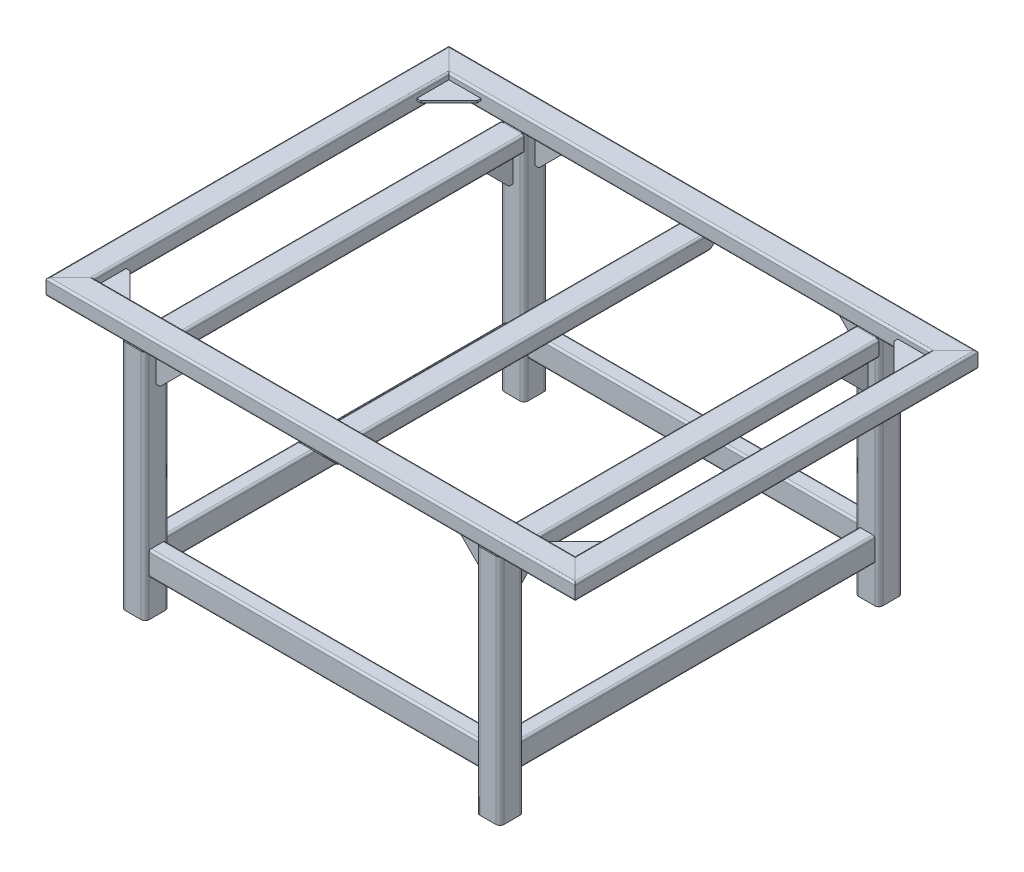
from build123d import *

# Parameters (mm, degrees)
PRINTNC_2X3X125_3_DEPTH            = 1246.790501198
PRINTNC_2X3X125_3_DEPTH_BACK       = 46.790501198
PRINTNC_2X3X125_3_2_DEPTH          = 1693.581002397
PRINTNC_2X3X125_3_3_DEPTH          = 1293.581002397
PRINTNC_2X3X125_3_4_DEPTH          = 1693.581002397
SQUARE_TUBE_3_X_3_X_0_25_3_DEPTH   = 762
SQUARE_TUBE_3_X_3_X_0_25_3_2_DEPTH = 762
SQUARE_TUBE_3_X_3_X_0_25_3_3_DEPTH = 762
SQUARE_TUBE_3_X_3_X_0_25_3_4_DEPTH = 762
PRINTNC_2X3X125_4_DEPTH            = 1170.590501198
PRINTNC_2X3X125_4_DEPTH_BACK       = 46.790501198
PRINTNC_2X3X125_4_2_DEPTH          = 1293.581002397
PRINTNC_2X3X125_4_3_DEPTH          = 1217.381002397
PRINTNC_2X3X125_4_4_DEPTH          = 1293.581002397
PRINTNC_2X3X125_5_DEPTH            = 1200
PRINTNC_2X3X125_5_2_DEPTH          = 1200
GUSSET2_THICKNESS                  = 6.35
GUSSET3_THICKNESS                  = 6.35
GUSSET4_THICKNESS                  = 6.35
GUSSET5_THICKNESS                  = 6.35
GUSSET10_THICKNESS                 = 6.35
GUSSET11_THICKNESS                 = 6.35
GUSSET12_THICKNESS                 = 6.35
GUSSET13_THICKNESS                 = 6.35
GUSSET14_DEPTH                     = 6.35
GUSSET15_DEPTH                     = 6.35
GUSSET16_DEPTH                     = 6.35
GUSSET17_START                     = -6.35
GUSSET17_DEPTH                     = 6.35
PRINTNC_2X3X125_6_DEPTH            = 1276.2
CUT_EXTRUDE1_DEPTH                 = 128


# Read off the part's stored shape, not the designer's step: Gusset14, Gusset15, Gusset16, Gusset17
with BuildPart() as part:
    # Sketch1 → Printnc 2X3X125(3) (new, two sides: drawn at the far end of the back side and taken through both)
    with BuildSketch(Plane(origin=(-800, 0, 600), x_dir=(1, 0, 0), z_dir=(0, 0, -1)).offset(-PRINTNC_2X3X125_3_DEPTH_BACK)):
        with BuildLine():
            Line((31.75, -25.4), (-31.75, -25.4))
            ThreePointArc((-31.75, -25.4), (-36.240128061, -23.540128061), (-38.1, -19.05))
            Line((-38.1, -19.05), (-38.1, 19.05))
            ThreePointArc((-38.1, 19.05), (-36.240128061, 23.540128061), (-31.75, 25.4))
            Line((-31.75, 25.4), (31.75, 25.4))
            ThreePointArc((31.75, 25.4), (36.240128061, 23.540128061), (38.1, 19.05))
            Line((38.1, 19.05), (38.1, -19.05))
            ThreePointArc((38.1, -19.05), (36.240128061, -23.540128061), (31.75, -25.4))
        make_face()
        with BuildLine():
            Line((31.75, 22.225), (-31.75, 22.225))
            ThreePointArc((-31.75, 22.225), (-33.99506403, 21.29506403), (-34.925, 19.05))
            Line((-34.925, 19.05), (-34.925, -19.05))
            ThreePointArc((-34.925, -19.05), (-33.99506403, -21.29506403), (-31.75, -22.225))
            Line((-31.75, -22.225), (31.75, -22.225))
            ThreePointArc((31.75, -22.225), (33.99506403, -21.29506403), (34.925, -19.05))
            Line((34.925, -19.05), (34.925, 19.05))
            ThreePointArc((34.925, 19.05), (33.99506403, 21.29506403), (31.75, 22.225))
        make_face(mode=Mode.SUBTRACT)
    extrude(amount=PRINTNC_2X3X125_3_DEPTH + PRINTNC_2X3X125_3_DEPTH_BACK)

    # Printnc 2X3X125(3) mitre 1
    split(bisect_by=Plane(origin=(-800, 0, 600), x_dir=(0, -1, 0), z_dir=(-0.707106781, 0, -0.707106781)), keep=Keep.TOP)

    # Printnc 2X3X125(3) mitre 2
    split(bisect_by=Plane(origin=(-800, 0, -600), x_dir=(0, -1, 0), z_dir=(-0.707106781, 0, 0.707106781)), keep=Keep.TOP)


with BuildPart() as body_2:
    # Sketch1 on segment 2 (carried to segment 2) → Printnc 2X3X125_3 2 (new body)
    with BuildSketch(Plane(origin=(-846.790501198, 0, -600), x_dir=(0, 0, 1), z_dir=(1, 0, 0))):
        with BuildLine():
            Line((31.75, -25.4), (-31.75, -25.4))
            ThreePointArc((-31.75, -25.4), (-36.240128061, -23.540128061), (-38.1, -19.05))
            Line((-38.1, -19.05), (-38.1, 19.05))
            ThreePointArc((-38.1, 19.05), (-36.240128061, 23.540128061), (-31.75, 25.4))
            Line((-31.75, 25.4), (31.75, 25.4))
            ThreePointArc((31.75, 25.4), (36.240128061, 23.540128061), (38.1, 19.05))
            Line((38.1, 19.05), (38.1, -19.05))
            ThreePointArc((38.1, -19.05), (36.240128061, -23.540128061), (31.75, -25.4))
        make_face()
        with BuildLine():
            Line((31.75, 22.225), (-31.75, 22.225))
            ThreePointArc((-31.75, 22.225), (-33.99506403, 21.29506403), (-34.925, 19.05))
            Line((-34.925, 19.05), (-34.925, -19.05))
            ThreePointArc((-34.925, -19.05), (-33.99506403, -21.29506403), (-31.75, -22.225))
            Line((-31.75, -22.225), (31.75, -22.225))
            ThreePointArc((31.75, -22.225), (33.99506403, -21.29506403), (34.925, -19.05))
            Line((34.925, -19.05), (34.925, 19.05))
            ThreePointArc((34.925, 19.05), (33.99506403, 21.29506403), (31.75, 22.225))
        make_face(mode=Mode.SUBTRACT)
    extrude(amount=PRINTNC_2X3X125_3_2_DEPTH)

    # Printnc 2X3X125_3 2 mitre 1
    split(bisect_by=Plane(origin=(800, 0, -600), x_dir=(0, -1, 0), z_dir=(-0.707106781, 0, -0.707106781)), keep=Keep.TOP)

    # Printnc 2X3X125_3 2 mitre 2
    split(bisect_by=Plane(origin=(-800, 0, -600), x_dir=(0, 1, 0), z_dir=(0.707106781, 0, -0.707106781)), keep=Keep.TOP)


with BuildPart() as body_3:
    # Sketch1 on segment 3 (carried to segment 3) → Printnc 2X3X125_3 3 (new body)
    with BuildSketch(Plane(origin=(800, 0, -646.790501198), x_dir=(-1, 0, 0), z_dir=(0, 0, 1))):
        with BuildLine():
            Line((31.75, -25.4), (-31.75, -25.4))
            ThreePointArc((-31.75, -25.4), (-36.240128061, -23.540128061), (-38.1, -19.05))
            Line((-38.1, -19.05), (-38.1, 19.05))
            ThreePointArc((-38.1, 19.05), (-36.240128061, 23.540128061), (-31.75, 25.4))
            Line((-31.75, 25.4), (31.75, 25.4))
            ThreePointArc((31.75, 25.4), (36.240128061, 23.540128061), (38.1, 19.05))
            Line((38.1, 19.05), (38.1, -19.05))
            ThreePointArc((38.1, -19.05), (36.240128061, -23.540128061), (31.75, -25.4))
        make_face()
        with BuildLine():
            Line((31.75, 22.225), (-31.75, 22.225))
            ThreePointArc((-31.75, 22.225), (-33.99506403, 21.29506403), (-34.925, 19.05))
            Line((-34.925, 19.05), (-34.925, -19.05))
            ThreePointArc((-34.925, -19.05), (-33.99506403, -21.29506403), (-31.75, -22.225))
            Line((-31.75, -22.225), (31.75, -22.225))
            ThreePointArc((31.75, -22.225), (33.99506403, -21.29506403), (34.925, -19.05))
            Line((34.925, -19.05), (34.925, 19.05))
            ThreePointArc((34.925, 19.05), (33.99506403, 21.29506403), (31.75, 22.225))
        make_face(mode=Mode.SUBTRACT)
    extrude(amount=PRINTNC_2X3X125_3_3_DEPTH)

    # Printnc 2X3X125_3 3 mitre 1
    split(bisect_by=Plane(origin=(800, 0, 600), x_dir=(0, 1, 0), z_dir=(0.707106781, 0, -0.707106781)), keep=Keep.TOP)

    # Printnc 2X3X125_3 3 mitre 2
    split(bisect_by=Plane(origin=(800, 0, -600), x_dir=(0, 1, 0), z_dir=(0.707106781, 0, 0.707106781)), keep=Keep.TOP)


with BuildPart() as body_4:
    # Sketch1 on segment 4 (carried to segment 4) → Printnc 2X3X125_3 4 (new body)
    with BuildSketch(Plane(origin=(846.790501198, 0, 600), x_dir=(0, 0, -1), z_dir=(-1, 0, 0))):
        with BuildLine():
            Line((31.75, -25.4), (-31.75, -25.4))
            ThreePointArc((-31.75, -25.4), (-36.240128061, -23.540128061), (-38.1, -19.05))
            Line((-38.1, -19.05), (-38.1, 19.05))
            ThreePointArc((-38.1, 19.05), (-36.240128061, 23.540128061), (-31.75, 25.4))
            Line((-31.75, 25.4), (31.75, 25.4))
            ThreePointArc((31.75, 25.4), (36.240128061, 23.540128061), (38.1, 19.05))
            Line((38.1, 19.05), (38.1, -19.05))
            ThreePointArc((38.1, -19.05), (36.240128061, -23.540128061), (31.75, -25.4))
        make_face()
        with BuildLine():
            Line((31.75, 22.225), (-31.75, 22.225))
            ThreePointArc((-31.75, 22.225), (-33.99506403, 21.29506403), (-34.925, 19.05))
            Line((-34.925, 19.05), (-34.925, -19.05))
            ThreePointArc((-34.925, -19.05), (-33.99506403, -21.29506403), (-31.75, -22.225))
            Line((-31.75, -22.225), (31.75, -22.225))
            ThreePointArc((31.75, -22.225), (33.99506403, -21.29506403), (34.925, -19.05))
            Line((34.925, -19.05), (34.925, 19.05))
            ThreePointArc((34.925, 19.05), (33.99506403, 21.29506403), (31.75, 22.225))
        make_face(mode=Mode.SUBTRACT)
    extrude(amount=PRINTNC_2X3X125_3_4_DEPTH)

    # Printnc 2X3X125_3 4 mitre 1
    split(bisect_by=Plane(origin=(800, 0, 600), x_dir=(0, -1, 0), z_dir=(-0.707106781, 0, 0.707106781)), keep=Keep.TOP)

    # Printnc 2X3X125_3 4 mitre 2
    split(bisect_by=Plane(origin=(-800, 0, 600), x_dir=(0, 1, 0), z_dir=(0.707106781, 0, 0.707106781)), keep=Keep.TOP)


with BuildPart() as body_5:
    # Sketch19 → Square tube 3 X 3 X 0.25(3) (new body)
    with BuildSketch(Plane(origin=(-561.9, 0, 600), x_dir=(1, 0, 0), z_dir=(0, -1, 0))):
        with BuildLine():
            Line((-25.4, -38.1), (25.4, -38.1))
            ThreePointArc((25.4, -38.1), (34.380256121, -34.380256121), (38.1, -25.4))
            Line((38.1, -25.4), (38.1, 25.4))
            ThreePointArc((38.1, 25.4), (34.380256121, 34.380256121), (25.4, 38.1))
            Line((25.4, 38.1), (-25.4, 38.1))
            ThreePointArc((-25.4, 38.1), (-34.380256121, 34.380256121), (-38.1, 25.4))
            Line((-38.1, 25.4), (-38.1, -25.4))
            ThreePointArc((-38.1, -25.4), (-34.380256121, -34.380256121), (-25.4, -38.1))
        make_face()
        with BuildLine():
            Line((-25.4, -31.75), (25.4, -31.75))
            ThreePointArc((25.4, -31.75), (29.890128061, -29.890128061), (31.75, -25.4))
            Line((31.75, -25.4), (31.75, 25.4))
            ThreePointArc((31.75, 25.4), (29.890128061, 29.890128061), (25.4, 31.75))
            Line((25.4, 31.75), (-25.4, 31.75))
            ThreePointArc((-25.4, 31.75), (-29.890128061, 29.890128061), (-31.75, 25.4))
            Line((-31.75, 25.4), (-31.75, -25.4))
            ThreePointArc((-31.75, -25.4), (-29.890128061, -29.890128061), (-25.4, -31.75))
        make_face(mode=Mode.SUBTRACT)
    extrude(amount=SQUARE_TUBE_3_X_3_X_0_25_3_DEPTH)

    # Trim/Extend1
    split(bisect_by=Plane(origin=(0, -25.4, 600.420026042), x_dir=(1, 0, 0), z_dir=(0, -1, 0)), keep=Keep.TOP)


with BuildPart() as body_6:
    # Sketch19 on segment 2 (carried to segment 2) → Square tube 3 X 3 X 0.25_3 2 (new body)
    with BuildSketch(Plane(origin=(-561.9, 0, -600), x_dir=(1, 0, 0), z_dir=(0, -1, 0))):
        with BuildLine():
            Line((-25.4, -38.1), (25.4, -38.1))
            ThreePointArc((25.4, -38.1), (34.380256121, -34.380256121), (38.1, -25.4))
            Line((38.1, -25.4), (38.1, 25.4))
            ThreePointArc((38.1, 25.4), (34.380256121, 34.380256121), (25.4, 38.1))
            Line((25.4, 38.1), (-25.4, 38.1))
            ThreePointArc((-25.4, 38.1), (-34.380256121, 34.380256121), (-38.1, 25.4))
            Line((-38.1, 25.4), (-38.1, -25.4))
            ThreePointArc((-38.1, -25.4), (-34.380256121, -34.380256121), (-25.4, -38.1))
        make_face()
        with BuildLine():
            Line((-25.4, -31.75), (25.4, -31.75))
            ThreePointArc((25.4, -31.75), (29.890128061, -29.890128061), (31.75, -25.4))
            Line((31.75, -25.4), (31.75, 25.4))
            ThreePointArc((31.75, 25.4), (29.890128061, 29.890128061), (25.4, 31.75))
            Line((25.4, 31.75), (-25.4, 31.75))
            ThreePointArc((-25.4, 31.75), (-29.890128061, 29.890128061), (-31.75, 25.4))
            Line((-31.75, 25.4), (-31.75, -25.4))
            ThreePointArc((-31.75, -25.4), (-29.890128061, -29.890128061), (-25.4, -31.75))
        make_face(mode=Mode.SUBTRACT)
    extrude(amount=SQUARE_TUBE_3_X_3_X_0_25_3_2_DEPTH)

    # Trim/Extend1
    split(bisect_by=Plane(origin=(0, -25.4, 600.420026042), x_dir=(1, 0, 0), z_dir=(0, -1, 0)), keep=Keep.TOP)


with BuildPart() as body_7:
    # Sketch19 on segment 3 (carried to segment 3) → Square tube 3 X 3 X 0.25_3 3 (new body)
    with BuildSketch(Plane(origin=(561.9, 0, -600), x_dir=(1, 0, 0), z_dir=(0, -1, 0))):
        with BuildLine():
            Line((-25.4, -38.1), (25.4, -38.1))
            ThreePointArc((25.4, -38.1), (34.380256121, -34.380256121), (38.1, -25.4))
            Line((38.1, -25.4), (38.1, 25.4))
            ThreePointArc((38.1, 25.4), (34.380256121, 34.380256121), (25.4, 38.1))
            Line((25.4, 38.1), (-25.4, 38.1))
            ThreePointArc((-25.4, 38.1), (-34.380256121, 34.380256121), (-38.1, 25.4))
            Line((-38.1, 25.4), (-38.1, -25.4))
            ThreePointArc((-38.1, -25.4), (-34.380256121, -34.380256121), (-25.4, -38.1))
        make_face()
        with BuildLine():
            Line((-25.4, -31.75), (25.4, -31.75))
            ThreePointArc((25.4, -31.75), (29.890128061, -29.890128061), (31.75, -25.4))
            Line((31.75, -25.4), (31.75, 25.4))
            ThreePointArc((31.75, 25.4), (29.890128061, 29.890128061), (25.4, 31.75))
            Line((25.4, 31.75), (-25.4, 31.75))
            ThreePointArc((-25.4, 31.75), (-29.890128061, 29.890128061), (-31.75, 25.4))
            Line((-31.75, 25.4), (-31.75, -25.4))
            ThreePointArc((-31.75, -25.4), (-29.890128061, -29.890128061), (-25.4, -31.75))
        make_face(mode=Mode.SUBTRACT)
    extrude(amount=SQUARE_TUBE_3_X_3_X_0_25_3_3_DEPTH)

    # Trim/Extend1
    split(bisect_by=Plane(origin=(0, -25.4, 600.420026042), x_dir=(1, 0, 0), z_dir=(0, -1, 0)), keep=Keep.TOP)


with BuildPart() as body_8:
    # Sketch19 on segment 4 (carried to segment 4) → Square tube 3 X 3 X 0.25_3 4 (new body)
    with BuildSketch(Plane(origin=(561.9, 0, 600), x_dir=(1, 0, 0), z_dir=(0, -1, 0))):
        with BuildLine():
            Line((-25.4, -38.1), (25.4, -38.1))
            ThreePointArc((25.4, -38.1), (34.380256121, -34.380256121), (38.1, -25.4))
            Line((38.1, -25.4), (38.1, 25.4))
            ThreePointArc((38.1, 25.4), (34.380256121, 34.380256121), (25.4, 38.1))
            Line((25.4, 38.1), (-25.4, 38.1))
            ThreePointArc((-25.4, 38.1), (-34.380256121, 34.380256121), (-38.1, 25.4))
            Line((-38.1, 25.4), (-38.1, -25.4))
            ThreePointArc((-38.1, -25.4), (-34.380256121, -34.380256121), (-25.4, -38.1))
        make_face()
        with BuildLine():
            Line((-25.4, -31.75), (25.4, -31.75))
            ThreePointArc((25.4, -31.75), (29.890128061, -29.890128061), (31.75, -25.4))
            Line((31.75, -25.4), (31.75, 25.4))
            ThreePointArc((31.75, 25.4), (29.890128061, 29.890128061), (25.4, 31.75))
            Line((25.4, 31.75), (-25.4, 31.75))
            ThreePointArc((-25.4, 31.75), (-29.890128061, 29.890128061), (-31.75, 25.4))
            Line((-31.75, 25.4), (-31.75, -25.4))
            ThreePointArc((-31.75, -25.4), (-29.890128061, -29.890128061), (-25.4, -31.75))
        make_face(mode=Mode.SUBTRACT)
    extrude(amount=SQUARE_TUBE_3_X_3_X_0_25_3_4_DEPTH)

    # Trim/Extend1
    split(bisect_by=Plane(origin=(0, -25.4, 600.420026042), x_dir=(1, 0, 0), z_dir=(0, -1, 0)), keep=Keep.TOP)


with BuildPart() as body_9:
    # Sketch110 → Printnc 2X3X125(4) (new, two sides: drawn at the far end of the back side and taken through both)
    with BuildSketch(Plane(origin=(-561.9, -608.489967589, 600), x_dir=(0, 1, 0), z_dir=(1, 0, 0)).offset(-PRINTNC_2X3X125_4_DEPTH_BACK)):
        with BuildLine():
            Line((31.75, -25.4), (-31.75, -25.4))
            ThreePointArc((-31.75, -25.4), (-36.240128061, -23.540128061), (-38.1, -19.05))
            Line((-38.1, -19.05), (-38.1, 19.05))
            ThreePointArc((-38.1, 19.05), (-36.240128061, 23.540128061), (-31.75, 25.4))
            Line((-31.75, 25.4), (31.75, 25.4))
            ThreePointArc((31.75, 25.4), (36.240128061, 23.540128061), (38.1, 19.05))
            Line((38.1, 19.05), (38.1, -19.05))
            ThreePointArc((38.1, -19.05), (36.240128061, -23.540128061), (31.75, -25.4))
        make_face()
        with BuildLine():
            Line((31.75, 22.225), (-31.75, 22.225))
            ThreePointArc((-31.75, 22.225), (-33.99506403, 21.29506403), (-34.925, 19.05))
            Line((-34.925, 19.05), (-34.925, -19.05))
            ThreePointArc((-34.925, -19.05), (-33.99506403, -21.29506403), (-31.75, -22.225))
            Line((-31.75, -22.225), (31.75, -22.225))
            ThreePointArc((31.75, -22.225), (33.99506403, -21.29506403), (34.925, -19.05))
            Line((34.925, -19.05), (34.925, 19.05))
            ThreePointArc((34.925, 19.05), (33.99506403, 21.29506403), (31.75, 22.225))
        make_face(mode=Mode.SUBTRACT)
    extrude(amount=PRINTNC_2X3X125_4_DEPTH + PRINTNC_2X3X125_4_DEPTH_BACK)

    # Printnc 2X3X125(4) mitre 1
    split(bisect_by=Plane(origin=(-561.9, -608.489967589, 600), x_dir=(0, 1, 0), z_dir=(0.707106781, 0, 0.707106781)), keep=Keep.TOP)

    # Printnc 2X3X125(4) mitre 2
    split(bisect_by=Plane(origin=(561.9, -608.489967589, 600), x_dir=(0, -1, 0), z_dir=(-0.707106781, 0, 0.707106781)), keep=Keep.TOP)

    # Trim/Extend2
    split(bisect_by=Plane(origin=(-523.8, -393.7, 600), x_dir=(0, 1, 0), z_dir=(1, 0, 0)), keep=Keep.TOP)

    # Trim_Extend2 3
    split(bisect_by=Plane(origin=(523.8, -393.7, 600), x_dir=(0, -1, 0), z_dir=(-1, 0, 0)), keep=Keep.TOP)


with BuildPart() as body_10:
    # Sketch110 on segment 2 (carried to segment 2) → Printnc 2X3X125_4 2 (new body)
    with BuildSketch(Plane(origin=(561.9, -608.489967589, 646.790501198), x_dir=(0, 1, 0), z_dir=(0, 0, -1))):
        with BuildLine():
            Line((31.75, -25.4), (-31.75, -25.4))
            ThreePointArc((-31.75, -25.4), (-36.240128061, -23.540128061), (-38.1, -19.05))
            Line((-38.1, -19.05), (-38.1, 19.05))
            ThreePointArc((-38.1, 19.05), (-36.240128061, 23.540128061), (-31.75, 25.4))
            Line((-31.75, 25.4), (31.75, 25.4))
            ThreePointArc((31.75, 25.4), (36.240128061, 23.540128061), (38.1, 19.05))
            Line((38.1, 19.05), (38.1, -19.05))
            ThreePointArc((38.1, -19.05), (36.240128061, -23.540128061), (31.75, -25.4))
        make_face()
        with BuildLine():
            Line((31.75, 22.225), (-31.75, 22.225))
            ThreePointArc((-31.75, 22.225), (-33.99506403, 21.29506403), (-34.925, 19.05))
            Line((-34.925, 19.05), (-34.925, -19.05))
            ThreePointArc((-34.925, -19.05), (-33.99506403, -21.29506403), (-31.75, -22.225))
            Line((-31.75, -22.225), (31.75, -22.225))
            ThreePointArc((31.75, -22.225), (33.99506403, -21.29506403), (34.925, -19.05))
            Line((34.925, -19.05), (34.925, 19.05))
            ThreePointArc((34.925, 19.05), (33.99506403, 21.29506403), (31.75, 22.225))
        make_face(mode=Mode.SUBTRACT)
    extrude(amount=PRINTNC_2X3X125_4_2_DEPTH)

    # Printnc 2X3X125_4 2 mitre 1
    split(bisect_by=Plane(origin=(561.9, -608.489967589, 600), x_dir=(0, 1, 0), z_dir=(0.707106781, 0, -0.707106781)), keep=Keep.TOP)

    # Printnc 2X3X125_4 2 mitre 2
    split(bisect_by=Plane(origin=(561.9, -608.489967589, -600), x_dir=(0, 1, 0), z_dir=(0.707106781, 0, 0.707106781)), keep=Keep.TOP)

    # Trim_Extend2 5
    split(bisect_by=Plane(origin=(561.9, -393.7, 561.9), x_dir=(0, 1, 0), z_dir=(0, 0, -1)), keep=Keep.TOP)

    # Trim_Extend2 7
    split(bisect_by=Plane(origin=(561.9, -393.7, -561.9), x_dir=(0, -1, 0), z_dir=(0, 0, 1)), keep=Keep.TOP)


with BuildPart() as body_11:
    # Sketch110 on segment 3 (carried to segment 3) → Printnc 2X3X125_4 3 (new body)
    with BuildSketch(Plane(origin=(608.690501198, -608.489967589, -600), x_dir=(0, 1, 0), z_dir=(-1, 0, 0))):
        with BuildLine():
            Line((31.75, -25.4), (-31.75, -25.4))
            ThreePointArc((-31.75, -25.4), (-36.240128061, -23.540128061), (-38.1, -19.05))
            Line((-38.1, -19.05), (-38.1, 19.05))
            ThreePointArc((-38.1, 19.05), (-36.240128061, 23.540128061), (-31.75, 25.4))
            Line((-31.75, 25.4), (31.75, 25.4))
            ThreePointArc((31.75, 25.4), (36.240128061, 23.540128061), (38.1, 19.05))
            Line((38.1, 19.05), (38.1, -19.05))
            ThreePointArc((38.1, -19.05), (36.240128061, -23.540128061), (31.75, -25.4))
        make_face()
        with BuildLine():
            Line((31.75, 22.225), (-31.75, 22.225))
            ThreePointArc((-31.75, 22.225), (-33.99506403, 21.29506403), (-34.925, 19.05))
            Line((-34.925, 19.05), (-34.925, -19.05))
            ThreePointArc((-34.925, -19.05), (-33.99506403, -21.29506403), (-31.75, -22.225))
            Line((-31.75, -22.225), (31.75, -22.225))
            ThreePointArc((31.75, -22.225), (33.99506403, -21.29506403), (34.925, -19.05))
            Line((34.925, -19.05), (34.925, 19.05))
            ThreePointArc((34.925, 19.05), (33.99506403, 21.29506403), (31.75, 22.225))
        make_face(mode=Mode.SUBTRACT)
    extrude(amount=PRINTNC_2X3X125_4_3_DEPTH)

    # Printnc 2X3X125_4 3 mitre 1
    split(bisect_by=Plane(origin=(-561.9, -608.489967589, -600), x_dir=(0, 1, 0), z_dir=(0.707106781, 0, -0.707106781)), keep=Keep.TOP)

    # Printnc 2X3X125_4 3 mitre 2
    split(bisect_by=Plane(origin=(561.9, -608.489967589, -600), x_dir=(0, -1, 0), z_dir=(-0.707106781, 0, -0.707106781)), keep=Keep.TOP)

    # Trim/Extend2
    split(bisect_by=Plane(origin=(-523.8, -393.7, 600), x_dir=(0, 1, 0), z_dir=(1, 0, 0)), keep=Keep.TOP)

    # Trim_Extend2 3
    split(bisect_by=Plane(origin=(523.8, -393.7, 600), x_dir=(0, -1, 0), z_dir=(-1, 0, 0)), keep=Keep.TOP)


with BuildPart() as body_12:
    # Sketch110 on segment 4 (carried to segment 4) → Printnc 2X3X125_4 4 (new body)
    with BuildSketch(Plane(origin=(-561.9, -608.489967589, -646.790501198), x_dir=(0, 1, 0), z_dir=(0, 0, 1))):
        with BuildLine():
            Line((31.75, -25.4), (-31.75, -25.4))
            ThreePointArc((-31.75, -25.4), (-36.240128061, -23.540128061), (-38.1, -19.05))
            Line((-38.1, -19.05), (-38.1, 19.05))
            ThreePointArc((-38.1, 19.05), (-36.240128061, 23.540128061), (-31.75, 25.4))
            Line((-31.75, 25.4), (31.75, 25.4))
            ThreePointArc((31.75, 25.4), (36.240128061, 23.540128061), (38.1, 19.05))
            Line((38.1, 19.05), (38.1, -19.05))
            ThreePointArc((38.1, -19.05), (36.240128061, -23.540128061), (31.75, -25.4))
        make_face()
        with BuildLine():
            Line((31.75, 22.225), (-31.75, 22.225))
            ThreePointArc((-31.75, 22.225), (-33.99506403, 21.29506403), (-34.925, 19.05))
            Line((-34.925, 19.05), (-34.925, -19.05))
            ThreePointArc((-34.925, -19.05), (-33.99506403, -21.29506403), (-31.75, -22.225))
            Line((-31.75, -22.225), (31.75, -22.225))
            ThreePointArc((31.75, -22.225), (33.99506403, -21.29506403), (34.925, -19.05))
            Line((34.925, -19.05), (34.925, 19.05))
            ThreePointArc((34.925, 19.05), (33.99506403, 21.29506403), (31.75, 22.225))
        make_face(mode=Mode.SUBTRACT)
    extrude(amount=PRINTNC_2X3X125_4_4_DEPTH)

    # Printnc 2X3X125_4 4 mitre 1
    split(bisect_by=Plane(origin=(-561.9, -608.489967589, 600), x_dir=(0, -1, 0), z_dir=(-0.707106781, 0, -0.707106781)), keep=Keep.TOP)

    # Printnc 2X3X125_4 4 mitre 2
    split(bisect_by=Plane(origin=(-561.9, -608.489967589, -600), x_dir=(0, -1, 0), z_dir=(-0.707106781, 0, 0.707106781)), keep=Keep.TOP)

    # Trim_Extend2 5
    split(bisect_by=Plane(origin=(561.9, -393.7, 561.9), x_dir=(0, 1, 0), z_dir=(0, 0, -1)), keep=Keep.TOP)

    # Trim_Extend2 7
    split(bisect_by=Plane(origin=(561.9, -393.7, -561.9), x_dir=(0, -1, 0), z_dir=(0, 0, 1)), keep=Keep.TOP)


with BuildPart() as body_13:
    # Sketch1111 → Printnc 2X3X125(5) (new body)
    with BuildSketch(Plane(origin=(561.9, -50.8, -600), x_dir=(1, 0, 0), z_dir=(0, 0, 1))):
        with BuildLine():
            Line((31.75, -25.4), (-31.75, -25.4))
            ThreePointArc((-31.75, -25.4), (-36.240128061, -23.540128061), (-38.1, -19.05))
            Line((-38.1, -19.05), (-38.1, 19.05))
            ThreePointArc((-38.1, 19.05), (-36.240128061, 23.540128061), (-31.75, 25.4))
            Line((-31.75, 25.4), (31.75, 25.4))
            ThreePointArc((31.75, 25.4), (36.240128061, 23.540128061), (38.1, 19.05))
            Line((38.1, 19.05), (38.1, -19.05))
            ThreePointArc((38.1, -19.05), (36.240128061, -23.540128061), (31.75, -25.4))
        make_face()
        with BuildLine():
            Line((31.75, 22.225), (-31.75, 22.225))
            ThreePointArc((-31.75, 22.225), (-33.99506403, 21.29506403), (-34.925, 19.05))
            Line((-34.925, 19.05), (-34.925, -19.05))
            ThreePointArc((-34.925, -19.05), (-33.99506403, -21.29506403), (-31.75, -22.225))
            Line((-31.75, -22.225), (31.75, -22.225))
            ThreePointArc((31.75, -22.225), (33.99506403, -21.29506403), (34.925, -19.05))
            Line((34.925, -19.05), (34.925, 19.05))
            ThreePointArc((34.925, 19.05), (33.99506403, 21.29506403), (31.75, 22.225))
        make_face(mode=Mode.SUBTRACT)
    extrude(amount=PRINTNC_2X3X125_5_DEPTH)

    # Trim/Extend4
    split(bisect_by=Plane(origin=(561.9, -393.7, 561.9), x_dir=(0, 1, 0), z_dir=(0, 0, -1)), keep=Keep.TOP)

    # Trim_Extend4 3
    split(bisect_by=Plane(origin=(561.9, -393.7, -561.9), x_dir=(0, -1, 0), z_dir=(0, 0, 1)), keep=Keep.TOP)


with BuildPart() as body_14:
    # Sketch1111 on segment 2 (carried to segment 2) → Printnc 2X3X125_5 2 (new body)
    with BuildSketch(Plane(origin=(-561.9, -50.8, -600), x_dir=(1, 0, 0), z_dir=(0, 0, 1))):
        with BuildLine():
            Line((31.75, -25.4), (-31.75, -25.4))
            ThreePointArc((-31.75, -25.4), (-36.240128061, -23.540128061), (-38.1, -19.05))
            Line((-38.1, -19.05), (-38.1, 19.05))
            ThreePointArc((-38.1, 19.05), (-36.240128061, 23.540128061), (-31.75, 25.4))
            Line((-31.75, 25.4), (31.75, 25.4))
            ThreePointArc((31.75, 25.4), (36.240128061, 23.540128061), (38.1, 19.05))
            Line((38.1, 19.05), (38.1, -19.05))
            ThreePointArc((38.1, -19.05), (36.240128061, -23.540128061), (31.75, -25.4))
        make_face()
        with BuildLine():
            Line((31.75, 22.225), (-31.75, 22.225))
            ThreePointArc((-31.75, 22.225), (-33.99506403, 21.29506403), (-34.925, 19.05))
            Line((-34.925, 19.05), (-34.925, -19.05))
            ThreePointArc((-34.925, -19.05), (-33.99506403, -21.29506403), (-31.75, -22.225))
            Line((-31.75, -22.225), (31.75, -22.225))
            ThreePointArc((31.75, -22.225), (33.99506403, -21.29506403), (34.925, -19.05))
            Line((34.925, -19.05), (34.925, 19.05))
            ThreePointArc((34.925, 19.05), (33.99506403, 21.29506403), (31.75, 22.225))
        make_face(mode=Mode.SUBTRACT)
    extrude(amount=PRINTNC_2X3X125_5_2_DEPTH)

    # Trim/Extend4
    split(bisect_by=Plane(origin=(561.9, -393.7, 561.9), x_dir=(0, 1, 0), z_dir=(0, 0, -1)), keep=Keep.TOP)

    # Trim_Extend4 3
    split(bisect_by=Plane(origin=(561.9, -393.7, -561.9), x_dir=(0, -1, 0), z_dir=(0, 0, 1)), keep=Keep.TOP)


with BuildPart() as body_15:
    # Gusset2: a gusset: a plate 6.35 thick in the corner of two members, its outline drawn in place
    gusset2_outline = Wire([Line((-523.8, -25.4, 603.175), (-523.8, -127, 603.175)), Line((-523.8, -127, 603.175), (-511.1, -127, 603.175)), Line((-511.1, -127, 603.175), (-422.2, -38.1, 603.175)), Line((-422.2, -38.1, 603.175), (-422.2, -25.4, 603.175)), Line((-422.2, -25.4, 603.175), (-523.8, -25.4, 603.175))])
    add(extrude(Face(gusset2_outline), amount=GUSSET2_THICKNESS, dir=(0, 0, -1)))


with BuildPart() as body_16:
    # Gusset3: a gusset: a plate 6.35 thick in the corner of two members, its outline drawn in place
    gusset3_outline = Wire([Line((523.8, -25.4, 596.825), (523.8, -127, 596.825)), Line((523.8, -127, 596.825), (511.1, -127, 596.825)), Line((511.1, -127, 596.825), (422.2, -38.1, 596.825)), Line((422.2, -38.1, 596.825), (422.2, -25.4, 596.825)), Line((422.2, -25.4, 596.825), (523.8, -25.4, 596.825))])
    add(extrude(Face(gusset3_outline), amount=GUSSET3_THICKNESS, dir=(0, 0, 1)))


with BuildPart() as body_17:
    # Gusset4: a gusset: a plate 6.35 thick in the corner of two members, its outline drawn in place
    gusset4_outline = Wire([Line((523.8, -25.4, -603.175), (523.8, -127, -603.175)), Line((523.8, -127, -603.175), (511.1, -127, -603.175)), Line((511.1, -127, -603.175), (422.2, -38.1, -603.175)), Line((422.2, -38.1, -603.175), (422.2, -25.4, -603.175)), Line((422.2, -25.4, -603.175), (523.8, -25.4, -603.175))])
    add(extrude(Face(gusset4_outline), amount=GUSSET4_THICKNESS, dir=(0, 0, 1)))


with BuildPart() as body_18:
    # Gusset5: a gusset: a plate 6.35 thick in the corner of two members, its outline drawn in place
    gusset5_outline = Wire([Line((-523.8, -25.4, -603.175), (-422.2, -25.4, -603.175)), Line((-422.2, -25.4, -603.175), (-422.2, -38.1, -603.175)), Line((-422.2, -38.1, -603.175), (-511.1, -127, -603.175)), Line((-511.1, -127, -603.175), (-523.8, -127, -603.175)), Line((-523.8, -127, -603.175), (-523.8, -25.4, -603.175))])
    add(extrude(Face(gusset5_outline), amount=GUSSET5_THICKNESS, dir=(0, 0, 1)))


with BuildPart() as body_19:
    # Gusset10: a gusset: a plate 6.35 thick in the corner of two members, its outline drawn in place
    gusset10_outline = Wire([Line((-558.725, -76.2, -561.9), (-558.725, -76.2, -460.3)), Line((-558.725, -76.2, -460.3), (-558.725, -88.9, -460.3)), Line((-558.725, -88.9, -460.3), (-558.725, -177.8, -549.2)), Line((-558.725, -177.8, -549.2), (-558.725, -177.8, -561.9)), Line((-558.725, -177.8, -561.9), (-558.725, -76.2, -561.9))])
    add(extrude(Face(gusset10_outline), amount=GUSSET10_THICKNESS, dir=(-1, 0, 0)))


with BuildPart() as body_20:
    # Gusset11: a gusset: a plate 6.35 thick in the corner of two members, its outline drawn in place
    gusset11_outline = Wire([Line((-565.075, -76.2, 561.9), (-565.075, -76.2, 460.3)), Line((-565.075, -76.2, 460.3), (-565.075, -88.9, 460.3)), Line((-565.075, -88.9, 460.3), (-565.075, -177.8, 549.2)), Line((-565.075, -177.8, 549.2), (-565.075, -177.8, 561.9)), Line((-565.075, -177.8, 561.9), (-565.075, -76.2, 561.9))])
    add(extrude(Face(gusset11_outline), amount=GUSSET11_THICKNESS, dir=(1, 0, 0)))


with BuildPart() as body_21:
    # Gusset12: a gusset: a plate 6.35 thick in the corner of two members, its outline drawn in place
    gusset12_outline = Wire([Line((558.725, -76.2, 561.9), (558.725, -76.2, 460.3)), Line((558.725, -76.2, 460.3), (558.725, -88.9, 460.3)), Line((558.725, -88.9, 460.3), (558.725, -177.8, 549.2)), Line((558.725, -177.8, 549.2), (558.725, -177.8, 561.9)), Line((558.725, -177.8, 561.9), (558.725, -76.2, 561.9))])
    add(extrude(Face(gusset12_outline), amount=GUSSET12_THICKNESS, dir=(1, 0, 0)))


with BuildPart() as body_22:
    # Gusset13: a gusset: a plate 6.35 thick in the corner of two members, its outline drawn in place
    gusset13_outline = Wire([Line((565.075, -76.2, -561.9), (565.075, -76.2, -460.3)), Line((565.075, -76.2, -460.3), (565.075, -88.9, -460.3)), Line((565.075, -88.9, -460.3), (565.075, -177.8, -549.2)), Line((565.075, -177.8, -549.2), (565.075, -177.8, -561.9)), Line((565.075, -177.8, -561.9), (565.075, -76.2, -561.9))])
    add(extrude(Face(gusset13_outline), amount=GUSSET13_THICKNESS, dir=(-1, 0, 0)))


with BuildPart() as body_23:
    # Gusset14 outline → Gusset14 (new body)
    with BuildSketch(Plane(origin=(0, 0, 0), x_dir=(1, 0, 0), z_dir=(0, 1, 0))):
        Polygon((660.3, -549.2), (660.3, -561.9), (761.9, -561.9), (761.9, -460.3), (749.2, -460.3), align=None)
    extrude(amount=GUSSET14_DEPTH)


with BuildPart() as body_24:
    # Gusset15 outline → Gusset15 (new body)
    with BuildSketch(Plane(origin=(0, 0, 0), x_dir=(1, 0, 0), z_dir=(0, 1, 0))):
        Polygon((749.2, 460.3), (761.9, 460.3), (761.9, 561.9), (660.3, 561.9), (660.3, 549.2), align=None)
    extrude(amount=GUSSET15_DEPTH)


with BuildPart() as body_25:
    # Gusset16 outline → Gusset16 (new body)
    with BuildSketch(Plane(origin=(0, 0, 0), x_dir=(1, 0, 0), z_dir=(0, 1, 0))):
        Polygon((-660.3, 549.2), (-660.3, 561.9), (-761.9, 561.9), (-761.9, 460.3), (-749.2, 460.3), align=None)
    extrude(amount=GUSSET16_DEPTH)


with BuildPart() as body_26:
    # Gusset17 outline → Gusset17 (new body)
    with BuildSketch(Plane(origin=(0, 0, 0), x_dir=(1, 0, 0), z_dir=(0, 1, 0)).offset(GUSSET17_START)):
        Polygon((-660.3, -561.9), (-660.3, -549.2), (-749.2, -460.3), (-761.9, -460.3), (-761.9, -561.9), align=None)
    extrude(amount=GUSSET17_DEPTH)


with BuildPart() as body_27:
    # Sketch1122 → Printnc 2X3X125(6) (new body)
    with BuildSketch(Plane(origin=(0, -50.8, -638.1), x_dir=(-1, 0, 0), z_dir=(0, 0, 1))):
        with BuildLine():
            Line((31.75, -25.4), (-31.75, -25.4))
            ThreePointArc((-31.75, -25.4), (-36.240128061, -23.540128061), (-38.1, -19.05))
            Line((-38.1, -19.05), (-38.1, 19.05))
            ThreePointArc((-38.1, 19.05), (-36.240128061, 23.540128061), (-31.75, 25.4))
            Line((-31.75, 25.4), (31.75, 25.4))
            ThreePointArc((31.75, 25.4), (36.240128061, 23.540128061), (38.1, 19.05))
            Line((38.1, 19.05), (38.1, -19.05))
            ThreePointArc((38.1, -19.05), (36.240128061, -23.540128061), (31.75, -25.4))
        make_face()
        with BuildLine():
            Line((31.75, 22.225), (-31.75, 22.225))
            ThreePointArc((-31.75, 22.225), (-33.99506403, 21.29506403), (-34.925, 19.05))
            Line((-34.925, 19.05), (-34.925, -19.05))
            ThreePointArc((-34.925, -19.05), (-33.99506403, -21.29506403), (-31.75, -22.225))
            Line((-31.75, -22.225), (31.75, -22.225))
            ThreePointArc((31.75, -22.225), (33.99506403, -21.29506403), (34.925, -19.05))
            Line((34.925, -19.05), (34.925, 19.05))
            ThreePointArc((34.925, 19.05), (33.99506403, 21.29506403), (31.75, 22.225))
        make_face(mode=Mode.SUBTRACT)
    extrude(amount=PRINTNC_2X3X125_6_DEPTH)

    # Sketch1123 → Cut-Extrude1 (cut)
    with BuildSketch(Plane.ZY.offset(38.1)):
        Polygon((-638.1, -25.4), (-491.834738503, -171.665261497), (-638.1, -171.682358054), align=None)
        Polygon((638.1, -171.682358054), (638.1, -25.4), (491.834738503, -171.665261497), align=None)
    extrude(amount=-CUT_EXTRUDE1_DEPTH, mode=Mode.SUBTRACT)


solid = Compound([part.part, body_2.part, body_3.part, body_4.part, body_5.part, body_6.part, body_7.part, body_8.part, body_9.part, body_10.part, body_11.part, body_12.part, body_13.part, body_14.part, body_15.part, body_16.part, body_17.part, body_18.part, body_19.part, body_20.part, body_21.part, body_22.part, body_23.part, body_24.part, body_25.part, body_26.part, body_27.part])
